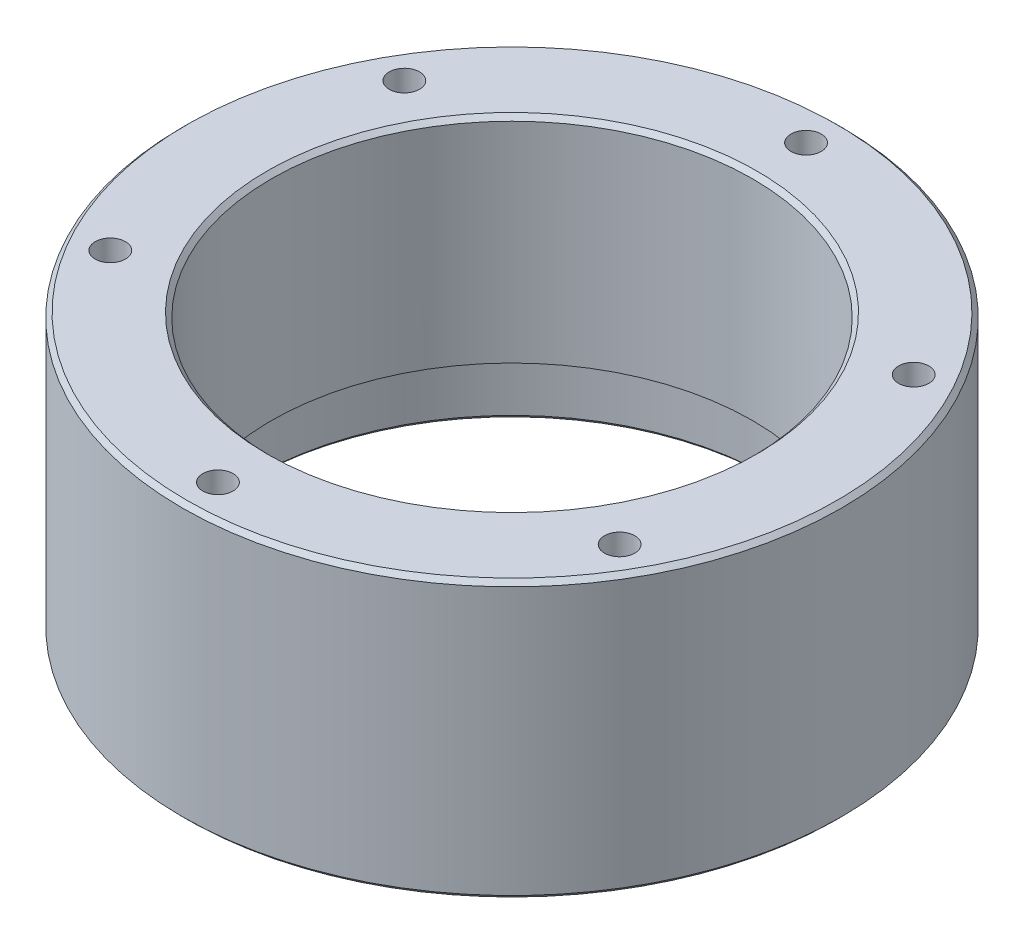
from build123d import *

# Parameters (mm, degrees)
CBORE_FOR_M3_HEX_SOCKET_HEAD_CAP_SCREW1_D           = 3.4
CBORE_FOR_M3_HEX_SOCKET_HEAD_CAP_SCREW1_CBORE_D     = 6.5
CBORE_FOR_M3_HEX_SOCKET_HEAD_CAP_SCREW1_CBORE_DEPTH = 3.4
F_0_5MM_CHAMFER1_SIZE                               = 0.5


with BuildPart() as part:
    # Sketch1 → Revolve1 (revolve)
    with BuildSketch(Plane.XY):
        Polygon((29, 0), (37, 0), (37, 31), (27, 31), (27, 7), (29, 7), align=None)
    revolve(axis=Axis((0, 0, 0), (0, 1, 0)))

    # CBORE for M3 Hex Socket Head Cap Screw1 (through all)
    with Locations(Plane(origin=(0, 0, 0), x_dir=(-1, 0, 0), z_dir=(0, -1, 0))):
        with Locations((28.578838325, -16.5), (0, -33), (-28.578838325, -16.5), (-28.578838325, 16.5), (0, 33), (28.578838325, 16.5)):
            CounterBoreHole(CBORE_FOR_M3_HEX_SOCKET_HEAD_CAP_SCREW1_D / 2, CBORE_FOR_M3_HEX_SOCKET_HEAD_CAP_SCREW1_CBORE_D / 2, CBORE_FOR_M3_HEX_SOCKET_HEAD_CAP_SCREW1_CBORE_DEPTH)

    # 0,5mm Chamfer1
    f_0_5mm_chamfer1_edges = [part.edges().sort_by_distance(p)[0] for p in [
        (-27, 31, 0),
        (-37, 31, 0),
        (-37, 0, 0),
        (-29, 0, 0),
    ]]
    chamfer(f_0_5mm_chamfer1_edges, length=F_0_5MM_CHAMFER1_SIZE)


solid = part.part
